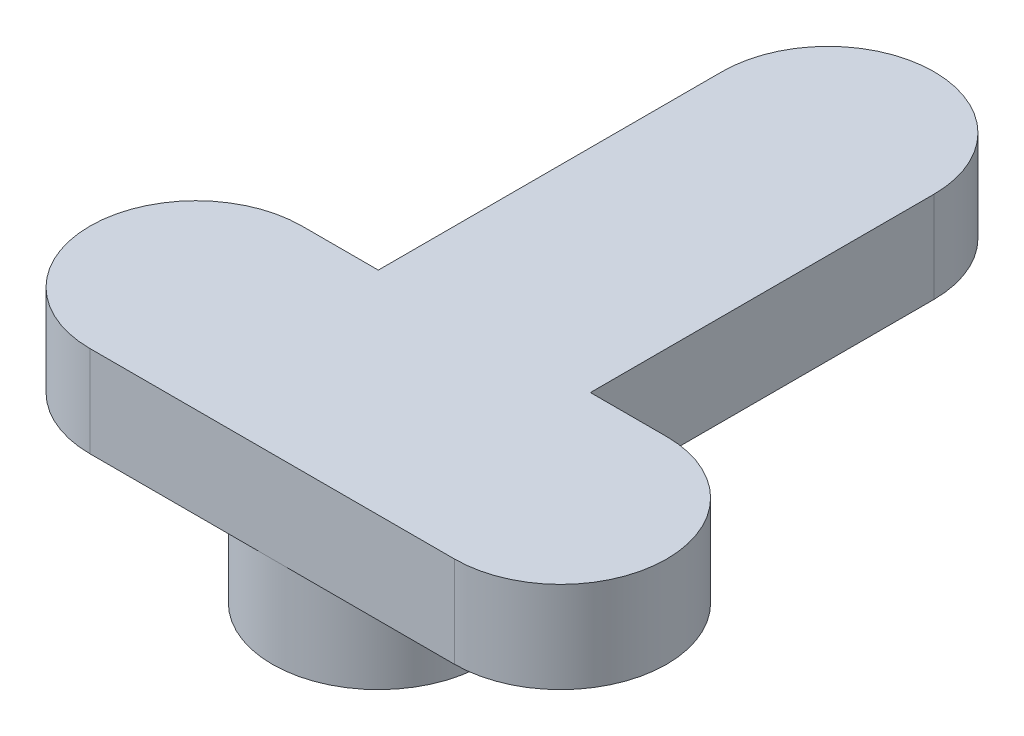
from build123d import *

# Parameters (mm, degrees)
SKETCH1_R           = 2.9546931
BOSS_EXTRUDE1_DEPTH = 2.54
BOSS_EXTRUDE2_DEPTH = 2.54


with BuildPart() as part:
    # Sketch1 → Boss-Extrude1 (new body)
    with BuildSketch(Plane(origin=(0, 0, 0), x_dir=(1, 0, 0), z_dir=(0, 1, 0))):
        Circle(SKETCH1_R)
    extrude(amount=BOSS_EXTRUDE1_DEPTH)

    # Sketch2 → Boss-Extrude2 (add)
    with BuildSketch(Plane(origin=(0, 2.54, 0), x_dir=(1, 0, 0), z_dir=(0, 1, 0))):
        with BuildLine():
            Line((-2.9546931, 2.9546931), (-5.08, 2.9546931))
            ThreePointArc((-5.08, 2.9546931), (-8.0346931, 0), (-5.08, -2.9546931))
            Line((-5.08, -2.9546931), (5.08, -2.9546931))
            ThreePointArc((5.08, -2.9546931), (8.0346931, 0), (5.08, 2.9546931))
            Line((5.08, 2.9546931), (2.9546931, 2.9546931))
            Line((2.9546931, 2.9546931), (2.9546931, 12.529616911))
            ThreePointArc((2.9546931, 12.529616911), (0, 15.484310011), (-2.9546931, 12.529616911))
            Line((-2.9546931, 12.529616911), (-2.9546931, 2.9546931))
        make_face()
    extrude(amount=BOSS_EXTRUDE2_DEPTH)


solid = part.part
